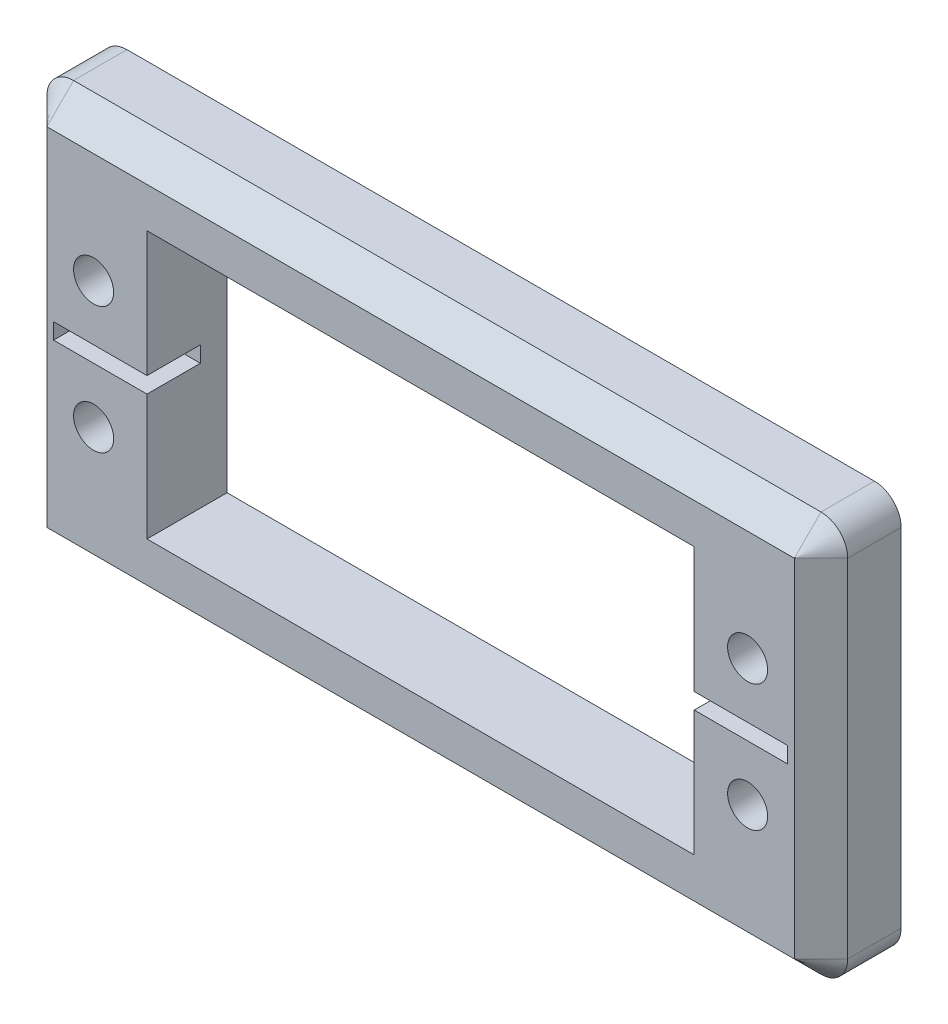
from build123d import *

# Parameters (mm, degrees)
SKETCH1_W           = 60
SKETCH1_H           = 30
BOSS_EXTRUDE1_DEPTH = 10
SKETCH2_W           = 41
SKETCH2_H           = 20
CUT_EXTRUDE1_DEPTH  = 10
SKETCH3_R           = 1.5
SKETCH3_W           = 14
SKETCH3_H           = 1.2
CUT_EXTRUDE2_DEPTH  = 4
FILLET1_R           = 2
CHAMFER1_SIZE       = 2
SKETCH5_W           = 145.508726569
SKETCH5_H           = 79.029504781
CUT_EXTRUDE3_DEPTH  = 4


with BuildPart() as part:
    # Sketch1 → Boss-Extrude1 (new body)
    with BuildSketch(Plane.XY):
        Rectangle(SKETCH1_W, SKETCH1_H)
    extrude(amount=BOSS_EXTRUDE1_DEPTH)

    # Sketch2 → Cut-Extrude1 (cut)
    with BuildSketch(Plane.XY.offset(10)):
        Rectangle(SKETCH2_W, SKETCH2_H)
    extrude(amount=-CUT_EXTRUDE1_DEPTH, mode=Mode.SUBTRACT)

    # Sketch3 → Cut-Extrude2 (cut)
    with BuildSketch(Plane.XY.offset(10)):
        with Locations((-24.5, 4.75)):
            Circle(SKETCH3_R)
        with Locations(Location((-24.5, -4.75, 0), (0, 0, 180))):
            Circle(SKETCH3_R)
        with Locations((24.5, -4.75)):
            Circle(SKETCH3_R)
        with Locations(Location((24.5, 4.75, 0), (0, 0, 180))):
            Circle(SKETCH3_R)
        with Locations((-20.5, 0)):
            Rectangle(SKETCH3_W, SKETCH3_H)
        with Locations((20.5, 0)):
            Rectangle(SKETCH3_W, SKETCH3_H)
    extrude(amount=-CUT_EXTRUDE2_DEPTH, mode=Mode.SUBTRACT)

    # Fillet1
    fillet1_edges = [part.edges().sort_by_distance(p)[0] for p in [
        (30, -15, 5),
        (-30, -15, 5),
        (-30, 15, 5),
        (30, 15, 5),
    ]]
    fillet(fillet1_edges, radius=FILLET1_R)

    # Chamfer1
    chamfer1_edges = [part.edges().sort_by_distance(p)[0] for p in [
        (0, 15, 10),
        (30, 0, 10),
        (-30, 0, 10),
        (0, -15, 10),
        (-29.414213562, 14.414213562, 10),
        (-29.414213562, -14.414213562, 10),
        (29.414213562, -14.414213562, 10),
        (29.414213562, 14.414213562, 10),
    ]]
    chamfer(chamfer1_edges, length=CHAMFER1_SIZE - 0.0001)  # a hair under: the kernel refuses the full size

    # Sketch5 → Cut-Extrude3 (cut)
    with BuildSketch(Plane(origin=(0, 0, 0), x_dir=(-1, 0, 0), z_dir=(0, 0, -1))):
        with Locations((-37.961499545, 20.658262846)):
            Rectangle(SKETCH5_W, SKETCH5_H)
    extrude(amount=-CUT_EXTRUDE3_DEPTH, mode=Mode.SUBTRACT)


solid = part.part
